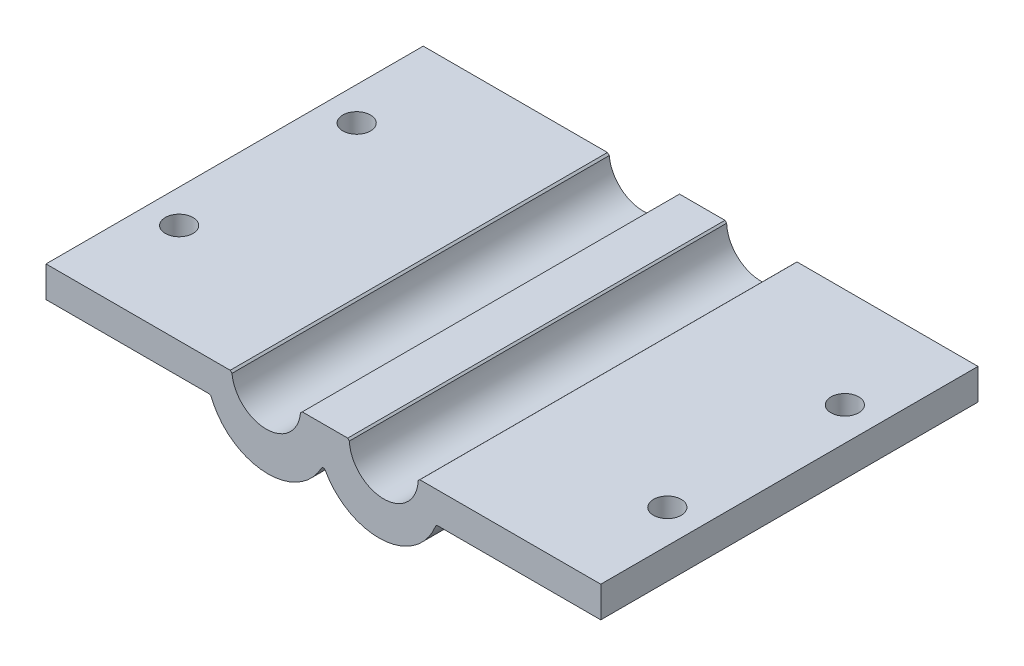
from build123d import *

# Parameters (mm, degrees)
SKETCH1_W           = 50
SKETCH1_H           = 34
BOSS_EXTRUDE1_DEPTH = 3
SKETCH2_W           = 38
SKETCH2_H           = 34
BOSS_EXTRUDE2_DEPTH = 3
SKETCH3_R           = 1.25
CUT_EXTRUDE1_DEPTH  = 3
BOSS_EXTRUDE3_DEPTH = 34
CUT_EXTRUDE4_DEPTH  = 43.626282972
SKETCH6_W           = 7
SKETCH6_H           = 4.004114793
CUT_EXTRUDE3_DEPTH  = 54.150729064
FILLET1_R           = 0.2
SKETCH8_W           = 4.910344877
SKETCH8_H           = 2.364797993
CUT_EXTRUDE5_DEPTH  = 43.626282972
FILLET2_R           = 0.5
SKETCH9_W           = 50
SKETCH9_H           = 6.499651724
CUT_EXTRUDE6_DEPTH  = 43.626282972
CHAMFER1_START      = -18
CHAMFER1_DEPTH      = 36


with BuildPart() as part:
    # Sketch1 → Boss-Extrude1 (new body)
    with BuildSketch(Plane(origin=(0, 0, 0), x_dir=(1, 0, 0), z_dir=(0, 1, 0))):
        Rectangle(SKETCH1_W, SKETCH1_H)
    extrude(amount=BOSS_EXTRUDE1_DEPTH)

    # Sketch2 → Boss-Extrude2 (add)
    with BuildSketch(Plane(origin=(0, 3, 0), x_dir=(1, 0, 0), z_dir=(0, 1, 0))):
        Rectangle(SKETCH2_W, SKETCH2_H)
    extrude(amount=BOSS_EXTRUDE2_DEPTH)

    # Sketch3 → Cut-Extrude1 (cut)
    with BuildSketch(Plane(origin=(0, 3, 0), x_dir=(1, 0, 0), z_dir=(0, 1, 0))):
        with Locations(Location((22, 8, 0), (0, 0, 270))):
            Circle(SKETCH3_R)
        with Locations(Location((22, -8, 0), (0, 0, 90))):
            Circle(SKETCH3_R)
        with Locations(Location((-22, -8, 0), (0, 0, 270))):
            Circle(SKETCH3_R)
        with Locations(Location((-22, 8, 0), (0, 0, 90))):
            Circle(SKETCH3_R)
    extrude(amount=-CUT_EXTRUDE1_DEPTH, mode=Mode.SUBTRACT)

    # Sketch5 → Boss-Extrude3 (add)
    with BuildSketch(Plane.XY.offset(17)):
        with BuildLine():
            Line((10.162882175, 0), (-10.162882175, 0))
            ThreePointArc((-10.162882175, 0), (-5.40902103, -3.588814383), (-0.175438596, -0.74480324))
            ThreePointArc((-0.175438596, -0.74480324), (0, -0.640830834), (0.175438596, -0.74480324))
            ThreePointArc((0.175438596, -0.74480324), (5.40902103, -3.588814383), (10.162882175, 0))
        make_face()
    extrude(amount=-BOSS_EXTRUDE3_DEPTH)

    # Sketch7 → Cut-Extrude4 (cut, through all)
    with BuildSketch(Plane(origin=(0, 0, -17), x_dir=(-1, 0, 0), z_dir=(0, 0, -1))):
        with BuildLine():
            Line((-8.541784002, 2.785692228), (-8.541784002, 8.770064047))
            Line((-8.541784002, 8.770064047), (8.249387021, 8.770064047))
            Line((8.249387021, 8.770064047), (8.249387021, 2.975059658))
            ThreePointArc((8.249387021, 2.975059658), (5.18491916, -0.185254174), (2.049991811, 2.905179016))
            Line((2.049991811, 2.905179016), (2.049991811, 5.195476311))
            Line((2.049991811, 5.195476311), (-2.343419325, 5.195476311))
            Line((-2.343419325, 5.195476311), (-2.343419325, 2.855696601))
            ThreePointArc((-2.343419325, 2.855696601), (-5.40689232, -0.341101373), (-8.541784002, 2.785692228))
        make_face()
    extrude(amount=-CUT_EXTRUDE4_DEPTH, mode=Mode.SUBTRACT)

    # Sketch6 → Cut-Extrude3 (cut, through all)
    with BuildSketch(Plane(origin=(25, 0, 0), x_dir=(0, 0, -1), z_dir=(1, 0, 0))):
        with Locations((0, -2.578040121)):
            Rectangle(SKETCH6_W, SKETCH6_H)
    extrude(amount=-CUT_EXTRUDE3_DEPTH, mode=Mode.SUBTRACT)

    # Fillet1
    fillet1_edges = [part.edges().sort_by_distance(p)[0] for p in [
        (10.162882175, 0, 0),
        (-10.162882175, 0, 0),
    ]]
    fillet(fillet1_edges, radius=FILLET1_R)

    # Sketch8 → Cut-Extrude5 (cut, through all)
    with BuildSketch(Plane(origin=(0, 0, -17), x_dir=(-1, 0, 0), z_dir=(0, 0, -1))):
        with Locations((-0.118869912, 4.00385134)):
            Rectangle(SKETCH8_W, SKETCH8_H)
    extrude(amount=-CUT_EXTRUDE5_DEPTH, mode=Mode.SUBTRACT)


with BuildPart() as cut_extrude5_kept_piece:
    # of the separate pieces the step leaves, the one the design keeps (cut_extrude5_pieces_kept)
    add(part.part.solids().sort_by_distance((-10.300657517, 0, -17))[0])

    # Fillet2
    fillet2_edges = [cut_extrude5_kept_piece.edges().sort_by_distance(p)[0] for p in [
        (8.541784002, 6, 0),
        (-8.249387021, 6, 0),
    ]]
    fillet(fillet2_edges, radius=FILLET2_R)

    # Sketch9 → Cut-Extrude6 (cut, through all)
    with BuildSketch(Plane(origin=(0, 0, -17), x_dir=(-1, 0, 0), z_dir=(0, 0, -1))):
        with Locations((0, 6.036788854)):
            Rectangle(SKETCH9_W, SKETCH9_H)
    extrude(amount=-CUT_EXTRUDE6_DEPTH, mode=Mode.SUBTRACT)

    # Chamfer1: read off the stored shape, not the designer's step
    # Chamfer1 outline → Chamfer1 (cut)
    with BuildSketch(Plane.XY.offset(CHAMFER1_START)):
        with BuildLine():
            ThreePointArc((8.541784002, 2.785692228), (8.541581007, 2.714125068), (8.539725958, 2.642581666))
            Line((8.539725958, 2.642581666), (8.689620689, 2.786962992))
            Line((8.689620689, 2.786962992), (8.541784002, 2.786962992))
            Line((8.541784002, 2.786962992), (8.541784002, 2.785692228))
        make_face()
        with BuildLine():
            Line((2.342030341, 2.786962992), (2.192030341, 2.786962992))
            Line((2.192030341, 2.786962992), (2.344386261, 2.634607072))
            ThreePointArc((2.344386261, 2.634607072), (2.342272067, 2.710770555), (2.342030341, 2.786962992))
        make_face()
        with BuildLine():
            ThreePointArc((-2.052604274, 2.786962992), (-2.05696798, 2.706483589), (-2.063422436, 2.62614483))
            Line((-2.063422436, 2.62614483), (-1.902604274, 2.786962992))
            Line((-1.902604274, 2.786962992), (-2.052604274, 2.786962992))
        make_face()
        with BuildLine():
            Line((-8.397351028, 2.786962992), (-8.236532866, 2.62614483))
            ThreePointArc((-8.236532866, 2.62614483), (-8.242987322, 2.706483589), (-8.247351028, 2.786962992))
            Line((-8.247351028, 2.786962992), (-8.397351028, 2.786962992))
        make_face()
    extrude(amount=CHAMFER1_DEPTH, mode=Mode.SUBTRACT)


solid = cut_extrude5_kept_piece.part
